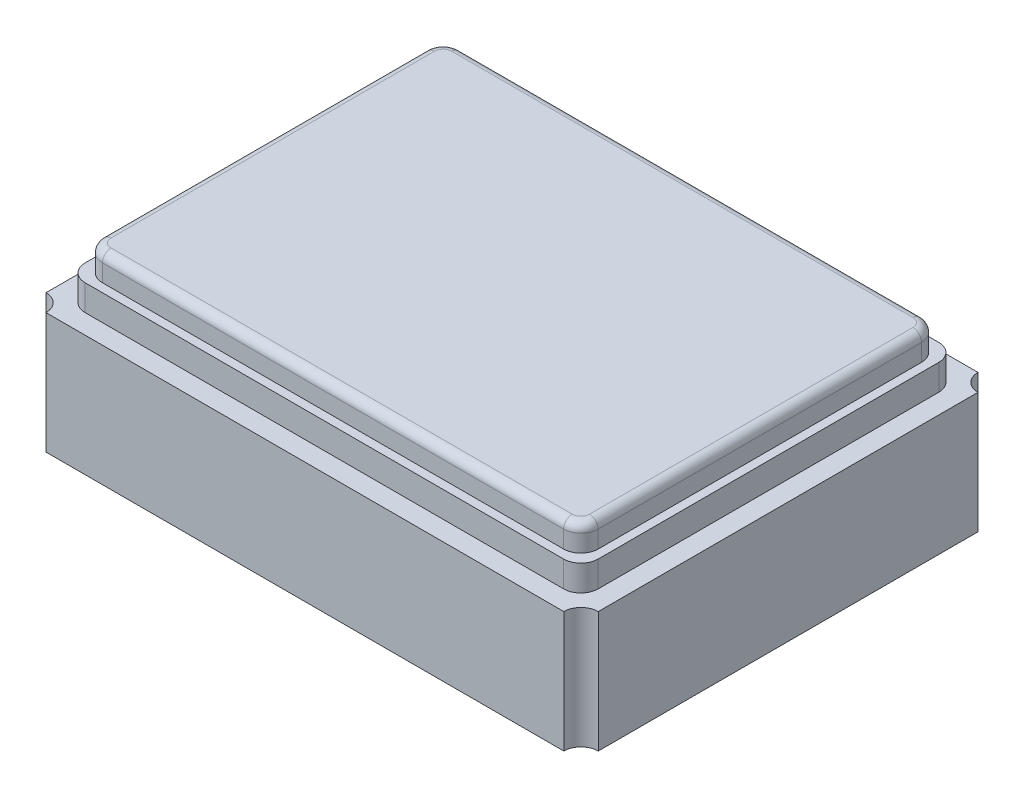
from build123d import *

# Parameters (mm, degrees)
SKETCH1_W           = 3.2
SKETCH1_H           = 2.4
BOSS_EXTRUDE1_DEPTH = 0.7
SKETCH2_R           = 0.1
CUT_EXTRUDE1_DEPTH  = 3.11896201
BOSS_EXTRUDE2_DEPTH = 0.15
BOSS_EXTRUDE3_DEPTH = 0.15
FILLET1_R           = 0.05


with BuildPart() as part:
    # Sketch1 → Boss-Extrude1 (new body)
    with BuildSketch(Plane(origin=(0, 0, 0), x_dir=(1, 0, 0), z_dir=(0, 1, 0))):
        Rectangle(SKETCH1_W, SKETCH1_H)
    extrude(amount=BOSS_EXTRUDE1_DEPTH)

    # Sketch2 → Cut-Extrude1 (cut, through all)
    with BuildSketch(Plane(origin=(0, 0.7, 0), x_dir=(1, 0, 0), z_dir=(0, 1, 0))):
        with Locations((-1.6, 1.2)):
            Circle(SKETCH2_R)
        with Locations((1.6, 1.2)):
            Circle(SKETCH2_R)
        with Locations((1.6, -1.2)):
            Circle(SKETCH2_R)
        with Locations((-1.6, -1.2)):
            Circle(SKETCH2_R)
    extrude(amount=-CUT_EXTRUDE1_DEPTH, mode=Mode.SUBTRACT)


with BuildPart() as body_2:
    # Sketch3 → Boss-Extrude2 (new body)
    with BuildSketch(Plane(origin=(0, 0.7, 0), x_dir=(1, 0, 0), z_dir=(0, 1, 0))):
        with BuildLine():
            Line((-1.386096781, -1.0868469), (1.386096781, -1.0868469))
            ThreePointArc((1.386096781, -1.0868469), (1.456807459, -1.057557578), (1.486096781, -0.9868469))
            Line((1.486096781, -0.9868469), (1.486096781, 0.9868469))
            ThreePointArc((1.486096781, 0.9868469), (1.456807459, 1.057557578), (1.386096781, 1.0868469))
            Line((1.386096781, 1.0868469), (-1.386096781, 1.0868469))
            ThreePointArc((-1.386096781, 1.0868469), (-1.456807459, 1.057557578), (-1.486096781, 0.9868469))
            Line((-1.486096781, 0.9868469), (-1.486096781, -0.9868469))
            ThreePointArc((-1.486096781, -0.9868469), (-1.456807459, -1.057557578), (-1.386096781, -1.0868469))
        make_face()
    extrude(amount=BOSS_EXTRUDE2_DEPTH)


with BuildPart() as body_3:
    # Sketch4 → Boss-Extrude3 (new body)
    with BuildSketch(Plane(origin=(0, 0.85, 0), x_dir=(1, 0, 0), z_dir=(0, 1, 0))):
        with BuildLine():
            Line((-1.336096781, -1.0368469), (1.336096781, -1.0368469))
            ThreePointArc((1.336096781, -1.0368469), (1.406807459, -1.007557578), (1.436096781, -0.9368469))
            Line((1.436096781, -0.9368469), (1.436096781, 0.9368469))
            ThreePointArc((1.436096781, 0.9368469), (1.406807459, 1.007557578), (1.336096781, 1.0368469))
            Line((1.336096781, 1.0368469), (-1.336096781, 1.0368469))
            ThreePointArc((-1.336096781, 1.0368469), (-1.406807459, 1.007557578), (-1.436096781, 0.9368469))
            Line((-1.436096781, 0.9368469), (-1.436096781, -0.9368469))
            ThreePointArc((-1.436096781, -0.9368469), (-1.406807459, -1.007557578), (-1.336096781, -1.0368469))
        make_face()
    extrude(amount=BOSS_EXTRUDE3_DEPTH)

    # Fillet1
    fillet1_edges = [body_3.edges().sort_by_distance(p)[0] for p in [
        (-1.436096781, 1, 0),
        (-1.406807459, 1, -1.007557578),
        (0, 1, -1.0368469),
        (1.406807459, 1, -1.007557578),
        (1.436096781, 1, 0),
        (1.406807459, 1, 1.007557578),
        (0, 1, 1.0368469),
        (-1.406807459, 1, 1.007557578),
    ]]
    fillet(fillet1_edges, radius=FILLET1_R)


solid = Compound([part.part, body_2.part, body_3.part])
